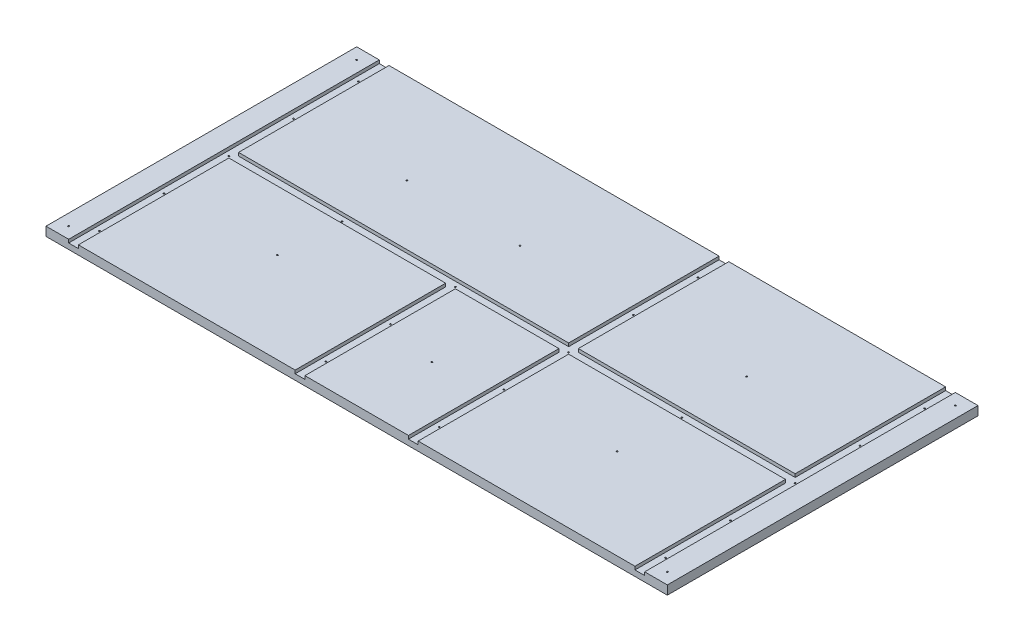
from build123d import *

# Parameters (mm, degrees)
SKETCH1_W               = 1219.2
SKETCH1_H               = 609.6
BOSS_EXTRUDE1_DEPTH     = 17.4752
CUT_EXTRUDE1_DEPTH      = 6.35
CUT_EXTRUDE2_DEPTH      = 682.644313462
CUT_EXTRUDE2_DEPTH_BACK = 682.644313462
SKETCH4_R               = 1.397


with BuildPart() as part:
    # Sketch1 → Boss-Extrude1 (new body)
    with BuildSketch(Plane(origin=(0, 0, 0), x_dir=(1, 0, 0), z_dir=(0, 1, 0))):
        Rectangle(SKETCH1_W, SKETCH1_H)
    extrude(amount=BOSS_EXTRUDE1_DEPTH)

    # Sketch2 → Cut-Extrude1 (cut)
    with BuildSketch(Plane(origin=(0, 17.4752, 0), x_dir=(1, 0, 0), z_dir=(0, 1, 0))):
        Polygon((-565.15, 304.8), (-546.1, 304.8), (-546.1, 9.525), (101.6, 9.525), (101.6, 304.8), (120.65, 304.8), (120.65, 9.525), (546.1, 9.525), (546.1, 304.8), (565.15, 304.8), (565.15, -304.8), (546.1, -304.8), (546.1, -9.525), (120.65, -9.525), (120.65, -304.8), (101.6, -304.8), (101.6, -9.525), (-101.6, -9.525), (-101.6, -304.8), (-120.65, -304.8), (-120.65, -9.525), (-546.1, -9.525), (-546.1, -304.8), (-565.15, -304.8), align=None)
    extrude(amount=-CUT_EXTRUDE1_DEPTH, mode=Mode.SUBTRACT)

    # Sketch4 → Cut-Extrude2 (cut, two sides: drawn at the far end of the back side and taken through both)
    with BuildSketch(Plane(origin=(0, 11.1252, 0), x_dir=(1, 0, 0), z_dir=(0, 1, 0)).offset(-CUT_EXTRUDE2_DEPTH_BACK)):
        with Locations((-555.625, 254)):
            Circle(SKETCH4_R)
        with Locations((111.125, 254)):
            Circle(SKETCH4_R)
        with Locations((555.625, 254)):
            Circle(SKETCH4_R)
        with Locations((-333.375, 127)):
            Circle(SKETCH4_R)
        with Locations((-111.125, 127)):
            Circle(SKETCH4_R)
        with Locations((111.125, 127)):
            Circle(SKETCH4_R)
        with Locations((333.375, 127)):
            Circle(SKETCH4_R)
        with Locations((555.625, 127)):
            Circle(SKETCH4_R)
        with Locations((-333.375, 0)):
            Circle(SKETCH4_R)
        with Locations((-111.125, 0)):
            Circle(SKETCH4_R)
        with Locations((111.125, 0)):
            Circle(SKETCH4_R)
        with Locations((333.375, 0)):
            Circle(SKETCH4_R)
        with Locations((555.625, 0)):
            Circle(SKETCH4_R)
        with Locations((-333.375, -127)):
            Circle(SKETCH4_R)
        with Locations((-111.125, -127)):
            Circle(SKETCH4_R)
        with Locations((111.125, -127)):
            Circle(SKETCH4_R)
        with Locations((333.375, -127)):
            Circle(SKETCH4_R)
        with Locations((555.625, -127)):
            Circle(SKETCH4_R)
        with Locations((-111.125, -254)):
            Circle(SKETCH4_R)
        with Locations((111.125, -254)):
            Circle(SKETCH4_R)
        with Locations((555.625, -254)):
            Circle(SKETCH4_R)
        with Locations((-555.625, 127)):
            Circle(SKETCH4_R)
        with Locations((-555.625, 0)):
            Circle(SKETCH4_R)
        with Locations((-555.625, -127)):
            Circle(SKETCH4_R)
        with Locations((-555.625, -254)):
            Circle(SKETCH4_R)
        with Locations((-587.375, 282.575)):
            Circle(SKETCH4_R)
        with Locations((587.375, 282.575)):
            Circle(SKETCH4_R)
        with Locations((587.375, -282.575)):
            Circle(SKETCH4_R)
        with Locations((-587.375, -282.575)):
            Circle(SKETCH4_R)
        with Locations((0, -157.1625)):
            Circle(SKETCH4_R)
    extrude(amount=CUT_EXTRUDE2_DEPTH + CUT_EXTRUDE2_DEPTH_BACK, mode=Mode.SUBTRACT)


solid = part.part
